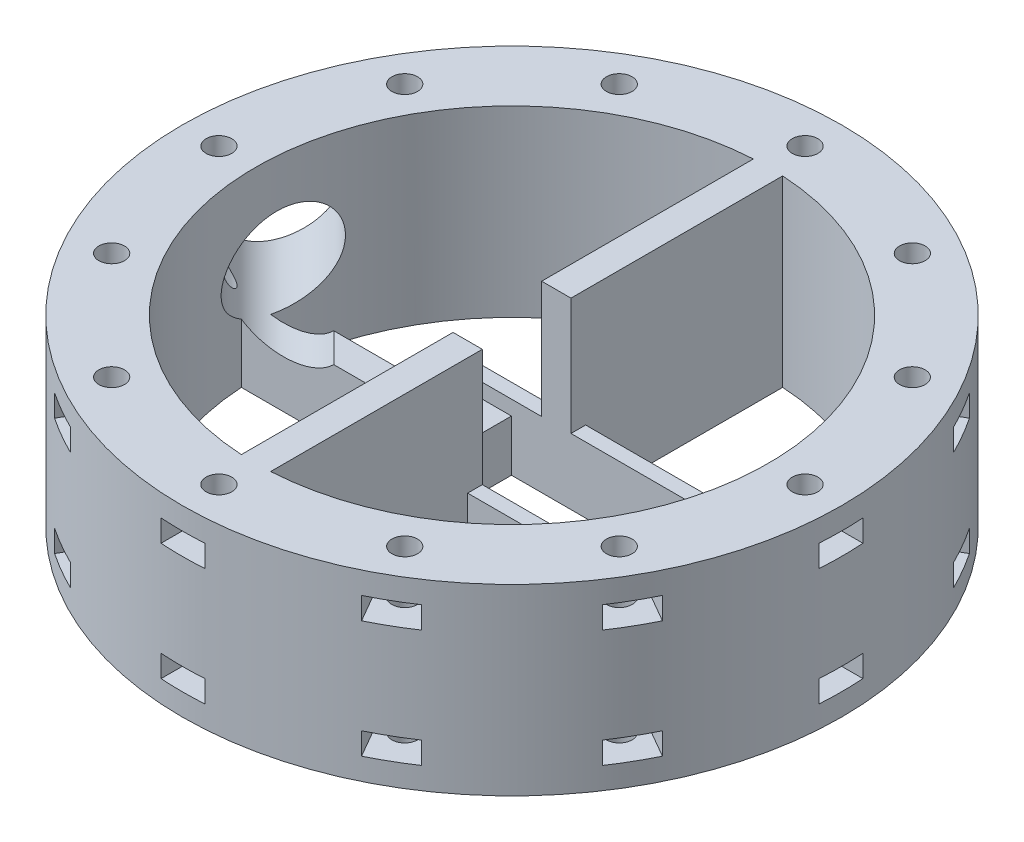
from build123d import *
from build123d.topology import SkipClean

# Parameters (mm, degrees)
SKETCH2_R           = 45
BOSS_EXTRUDE1_DEPTH = 9
SKETCH3_W           = 32.25
SKETCH3_H           = 12.1
CUT_EXTRUDE1_DEPTH  = 2
SKETCH4_W           = 22.6
SKETCH4_H           = 12.1
CUT_EXTRUDE2_DEPTH  = 65.02343321
SKETCH6_R           = 1
CUT_EXTRUDE4_DEPTH  = 65.02343321
CUT_EXTRUDE5_DEPTH  = 65.272855857
BOSS_EXTRUDE2_START = 16
SKETCH13_R          = 45
BOSS_EXTRUDE2_DEPTH = 16
SKETCH10_R          = 1.75
CUT_EXTRUDE7_DEPTH  = 69.373971656
CUT_EXTRUDE8_DEPTH  = 3
SKETCH15_R          = 6
CUT_EXTRUDE9_DEPTH  = 69.373971656


with BuildPart() as part:
    # Sketch2 → Boss-Extrude1 (new body)
    with BuildSketch(Plane(origin=(0, 0, 0), x_dir=(1, 0, 0), z_dir=(0, 1, 0))):
        Circle(SKETCH2_R)
    extrude(amount=BOSS_EXTRUDE1_DEPTH)

    # Sketch3 → Cut-Extrude1 (cut)
    with BuildSketch(Plane(origin=(0, 9, 0), x_dir=(1, 0, 0), z_dir=(0, 1, 0))):
        with Locations((5.175, 0)):
            Rectangle(SKETCH3_W, SKETCH3_H)
    extrude(amount=-CUT_EXTRUDE1_DEPTH, mode=Mode.SUBTRACT)

    # Sketch4 → Cut-Extrude2 (cut, through all)
    with BuildSketch(Plane(origin=(0, 7, 0), x_dir=(1, 0, 0), z_dir=(0, 1, 0))):
        with Locations((5.175, 0)):
            Rectangle(SKETCH4_W, SKETCH4_H)
    extrude(amount=-CUT_EXTRUDE2_DEPTH, mode=Mode.SUBTRACT)

    # Sketch6 → Cut-Extrude4 (cut, through all)
    with BuildSketch(Plane(origin=(0, 7, 0), x_dir=(1, 0, 0), z_dir=(0, 1, 0))):
        with Locations((-8.675, 0)):
            Circle(SKETCH6_R)
        with Locations((19.025, 0)):
            Circle(SKETCH6_R)
    extrude(amount=-CUT_EXTRUDE4_DEPTH, mode=Mode.SUBTRACT)

    # Sketch9 → Cut-Extrude5 (cut, through all)
    with BuildSketch(Plane(origin=(0, 9, 0), x_dir=(1, 0, 0), z_dir=(0, 1, 0))):
        with BuildLine():
            Line((-12.95, 8.05), (-2, 8.05))
            Line((-2, 8.05), (-2, 34.942810419))
            ThreePointArc((-2, 34.942810419), (-24.748737342, 24.748737342), (-34.942810419, 2))
            Line((-34.942810419, 2), (-12.95, 2))
            Line((-12.95, 2), (-12.95, 8.05))
        make_face()
        with BuildLine():
            Line((-12.95, -8.05), (-2, -8.05))
            Line((-2, -8.05), (-2, -34.942810419))
            ThreePointArc((-2, -34.942810419), (-24.748737342, -24.748737342), (-34.942810419, -2))
            Line((-34.942810419, -2), (-12.95, -2))
            Line((-12.95, -2), (-12.95, -8.05))
        make_face()
        with BuildLine():
            Line((2, 34.942810419), (2, 8.05))
            Line((2, 8.05), (34.061672008, 8.05))
            ThreePointArc((34.061672008, 8.05), (22.492595672, 26.815725609), (2, 34.942810419))
        make_face()
        with BuildLine():
            Line((2, -34.942810419), (2, -8.05))
            Line((2, -8.05), (34.061672008, -8.05))
            ThreePointArc((34.061672008, -8.05), (22.492595672, -26.815725609), (2, -34.942810419))
        make_face()
    extrude(amount=-CUT_EXTRUDE5_DEPTH, mode=Mode.SUBTRACT)

    # Sketch13 → Boss-Extrude2 (add)
    with SkipClean():  # the faces are left unmerged after this step: merging them gives an invalid solid
        with BuildSketch(Plane(origin=(0, 9, 0), x_dir=(1, 0, 0), z_dir=(0, 1, 0)).offset(BOSS_EXTRUDE2_START)):
            Circle(SKETCH13_R)
            with BuildLine():
                Line((2, -34.942810419), (2, -8.05))
                Line((2, -8.05), (2, -6.05))
                Line((2, -6.05), (-2, -6.05))
                Line((-2, -6.05), (-2, -8.05))
                Line((-2, -8.05), (-2, -34.942810419))
                ThreePointArc((-2, -34.942810419), (-26.122511764, -23.294084639), (-34.942810419, 2))
                ThreePointArc((-34.942810419, 2), (-24.748737342, 24.748737342), (-2, 34.942810419))
                Line((-2, 34.942810419), (-2, 6.05))
                Line((-2, 6.05), (2, 6.05))
                Line((2, 6.05), (2, 34.942810419))
                ThreePointArc((2, 34.942810419), (25.10008578, 24.392328586), (34.985711369, 1))
                ThreePointArc((34.985711369, 1), (25.786762429, -23.665225193), (2, -34.942810419))
            make_face(mode=Mode.SUBTRACT)
        extrude(amount=-BOSS_EXTRUDE2_DEPTH)

    # Sketch10 → Cut-Extrude7 (cut, through all)
    with SkipClean():  # the faces are left unmerged after this step: merging them gives an invalid solid
        with BuildSketch(Plane.XZ):
            with Locations((-40, 0)):
                Circle(SKETCH10_R)
            with Locations((-34.641016151, 20)):
                Circle(SKETCH10_R)
            with Locations((-20, 34.641016151)):
                Circle(SKETCH10_R)
            with Locations((0, 40)):
                Circle(SKETCH10_R)
            with Locations((20, 34.641016151)):
                Circle(SKETCH10_R)
            with Locations((34.641016151, 20)):
                Circle(SKETCH10_R)
            with Locations((40, 0)):
                Circle(SKETCH10_R)
            with Locations((34.641016151, -20)):
                Circle(SKETCH10_R)
            with Locations((20, -34.641016151)):
                Circle(SKETCH10_R)
            with Locations((0, -40)):
                Circle(SKETCH10_R)
            with Locations((-20, -34.641016151)):
                Circle(SKETCH10_R)
            with Locations((-34.641016151, -20)):
                Circle(SKETCH10_R)
        extrude(amount=-CUT_EXTRUDE7_DEPTH, mode=Mode.SUBTRACT)

    # Sketch14 → Cut-Extrude8 (cut)
    with BuildSketch(Plane(origin=(0, 22, 0), x_dir=(1, 0, 0), z_dir=(0, 1, 0))):
        with BuildLine():
            Line((31.641016151, -18.267949192), (31.641016151, -21.732050808))
            Line((31.641016151, -21.732050808), (37.38444419, -25.048020532))
            ThreePointArc((37.38444419, -25.048020532), (38.97114317, -22.5), (40.38444419, -19.851868109))
            Line((40.38444419, -19.851868109), (34.641016151, -16.535898385))
            Line((34.641016151, -16.535898385), (31.641016151, -18.267949192))
        make_face()
        with BuildLine():
            Line((36.535898385, 0), (38.267949192, -3))
            Line((38.267949192, -3), (44.899888641, -3))
            ThreePointArc((44.899888641, -3), (45, 0), (44.899888641, 3))
            Line((44.899888641, 3), (38.267949192, 3))
            Line((38.267949192, 3), (36.535898385, 0))
        make_face()
        with BuildLine():
            Line((18.267949192, -31.641016151), (16.535898385, -34.641016151))
            Line((16.535898385, -34.641016151), (19.851868109, -40.38444419))
            ThreePointArc((19.851868109, -40.38444419), (22.5, -38.97114317), (25.048020532, -37.38444419))
            Line((25.048020532, -37.38444419), (21.732050808, -31.641016151))
            Line((21.732050808, -31.641016151), (18.267949192, -31.641016151))
        make_face()
        with BuildLine():
            Line((0, -36.535898385), (-3, -38.267949192))
            Line((-3, -38.267949192), (-3, -44.899888641))
            ThreePointArc((-3, -44.899888641), (0, -45), (3, -44.899888641))
            Line((3, -44.899888641), (3, -38.267949192))
            Line((3, -38.267949192), (0, -36.535898385))
        make_face()
        with BuildLine():
            Line((-18.267949192, -31.641016151), (-21.732050808, -31.641016151))
            Line((-21.732050808, -31.641016151), (-25.048020532, -37.38444419))
            ThreePointArc((-25.048020532, -37.38444419), (-22.5, -38.97114317), (-19.851868109, -40.38444419))
            Line((-19.851868109, -40.38444419), (-16.535898385, -34.641016151))
            Line((-16.535898385, -34.641016151), (-18.267949192, -31.641016151))
        make_face()
        with BuildLine():
            Line((-31.641016151, -18.267949192), (-34.641016151, -16.535898385))
            Line((-34.641016151, -16.535898385), (-40.38444419, -19.851868109))
            ThreePointArc((-40.38444419, -19.851868109), (-38.97114317, -22.5), (-37.38444419, -25.048020532))
            Line((-37.38444419, -25.048020532), (-31.641016151, -21.732050808))
            Line((-31.641016151, -21.732050808), (-31.641016151, -18.267949192))
        make_face()
        with BuildLine():
            Line((-36.535898385, 0), (-38.267949192, 3))
            Line((-38.267949192, 3), (-44.899888641, 3))
            ThreePointArc((-44.899888641, 3), (-45, 0), (-44.899888641, -3))
            Line((-44.899888641, -3), (-38.267949192, -3))
            Line((-38.267949192, -3), (-36.535898385, 0))
        make_face()
        with BuildLine():
            Line((-31.641016151, 18.267949192), (-31.641016151, 21.732050808))
            Line((-31.641016151, 21.732050808), (-37.38444419, 25.048020532))
            ThreePointArc((-37.38444419, 25.048020532), (-38.97114317, 22.5), (-40.38444419, 19.851868109))
            Line((-40.38444419, 19.851868109), (-34.641016151, 16.535898385))
            Line((-34.641016151, 16.535898385), (-31.641016151, 18.267949192))
        make_face()
        with BuildLine():
            Line((-18.267949192, 31.641016151), (-16.535898385, 34.641016151))
            Line((-16.535898385, 34.641016151), (-19.851868109, 40.38444419))
            ThreePointArc((-19.851868109, 40.38444419), (-22.5, 38.97114317), (-25.048020532, 37.38444419))
            Line((-25.048020532, 37.38444419), (-21.732050808, 31.641016151))
            Line((-21.732050808, 31.641016151), (-18.267949192, 31.641016151))
        make_face()
        with BuildLine():
            Line((0, 36.535898385), (3, 38.267949192))
            Line((3, 38.267949192), (3, 44.899888641))
            ThreePointArc((3, 44.899888641), (0, 45), (-3, 44.899888641))
            Line((-3, 44.899888641), (-3, 38.267949192))
            Line((-3, 38.267949192), (0, 36.535898385))
        make_face()
        with BuildLine():
            Line((18.267949192, 31.641016151), (21.732050808, 31.641016151))
            Line((21.732050808, 31.641016151), (25.048020532, 37.38444419))
            ThreePointArc((25.048020532, 37.38444419), (22.5, 38.97114317), (19.851868109, 40.38444419))
            Line((19.851868109, 40.38444419), (16.535898385, 34.641016151))
            Line((16.535898385, 34.641016151), (18.267949192, 31.641016151))
        make_face()
        with BuildLine():
            Line((31.641016151, 18.267949192), (34.641016151, 16.535898385))
            Line((34.641016151, 16.535898385), (40.38444419, 19.851868109))
            ThreePointArc((40.38444419, 19.851868109), (38.97114317, 22.5), (37.38444419, 25.048020532))
            Line((37.38444419, 25.048020532), (31.641016151, 21.732050808))
            Line((31.641016151, 21.732050808), (31.641016151, 18.267949192))
        make_face()
    cut_extrude8 = extrude(amount=-CUT_EXTRUDE8_DEPTH, mode=Mode.SUBTRACT)

    # Mirror1: Cut-Extrude8 across plane
    add(cut_extrude8.mirror(Plane.ZX.offset(12.5)), mode=Mode.SUBTRACT)

    # Sketch15 → Cut-Extrude9 (cut, through all)
    with BuildSketch(Plane(origin=(0, 0, 0), x_dir=(-0.7071067811865477, 0, 0.7071067811865474), z_dir=(-0.7071067811865474, 0, -0.7071067811865477))):
        with Locations((22.073209586, 12.5)):
            Circle(SKETCH15_R)
    extrude(amount=CUT_EXTRUDE9_DEPTH, mode=Mode.SUBTRACT)


solid = part.part
